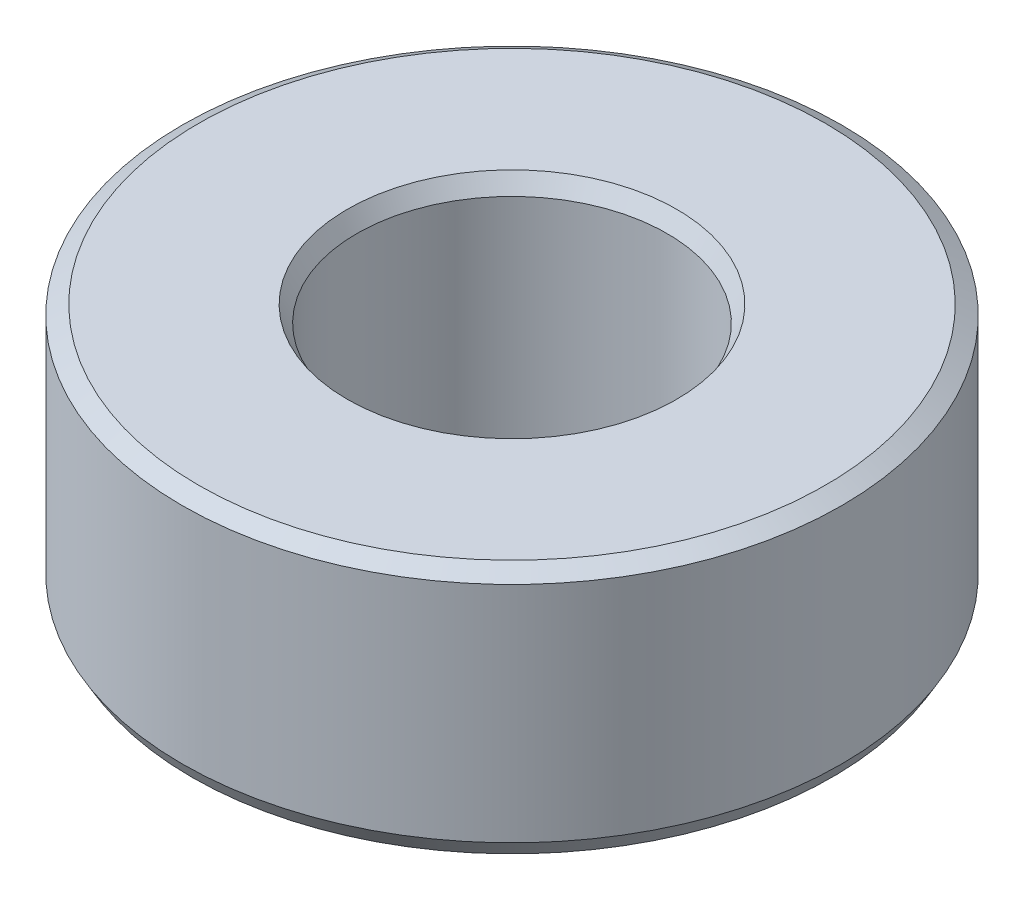
from build123d import *
from OCP.BRepFilletAPI import BRepFilletAPI_MakeChamfer

# Parameters (mm, degrees)
SKETCH1_R           = 42.5
BOSS_EXTRUDE1_DEPTH = 32.165456975
SKETCH2_R           = 20.000723555
CUT_EXTRUDE1_DEPTH  = 69.169763256
CHAMFER1_SIZE       = 1.22924229
CHAMFER1_SIZE2      = 2.096885179


with BuildPart() as part:
    # Sketch1 → Boss-Extrude1 (new body)
    with BuildSketch(Plane(origin=(0, 0, 0), x_dir=(1, 0, 0), z_dir=(0, 1, 0))):
        Circle(SKETCH1_R)
    extrude(amount=BOSS_EXTRUDE1_DEPTH)

    # Sketch2 → Cut-Extrude1 (cut, through all)
    with BuildSketch(Plane(origin=(0, 0, 0), x_dir=(1, 0, 0), z_dir=(0, 1, 0))):
        Circle(SKETCH2_R)
    extrude(amount=CUT_EXTRUDE1_DEPTH, mode=Mode.SUBTRACT)

    # Chamfer1: one chamfer whose edges measure the first distance from different faces: ONE call of the kernel's chamfer builder (chamfer() names one face for all edges)
    chamfer1_edges_1 = [part.edges().sort_by_distance(p)[0] for p in [
        (-20.000723555, 32.165456975, 0),
    ]]
    chamfer1_side_1 = [part.faces().sort_by_distance(p)[0] for p in [
        (-41.297918472, 32.165456975, 0),
    ]]
    chamfer1_edges_2 = [part.edges().sort_by_distance(p)[0] for p in [
        (-20.000723555, 0, 0),
    ]]
    chamfer1_side_2 = [part.faces().sort_by_distance(p)[0] for p in [
        (-20.000723555, 16.082728487, 0),
    ]]
    chamfer1_edges_3 = [part.edges().sort_by_distance(p)[0] for p in [
        (-42.5, 0, 0),
    ]]
    chamfer1_side_3 = [part.faces().sort_by_distance(p)[0] for p in [
        (-41.297918472, 0, 0),
    ]]
    chamfer1_edges_4 = [part.edges().sort_by_distance(p)[0] for p in [
        (-42.5, 32.165456975, 0),
    ]]
    chamfer1_side_4 = [part.faces().sort_by_distance(p)[0] for p in [
        (-42.5, 16.082728487, 0),
    ]]
    chamfer1 = BRepFilletAPI_MakeChamfer(part.part.solid().wrapped)
    for e in chamfer1_edges_1:
        chamfer1.Add(CHAMFER1_SIZE, CHAMFER1_SIZE2, e.wrapped, chamfer1_side_1[0].wrapped)  # the first distance lies on this face
    for e in chamfer1_edges_2:
        chamfer1.Add(CHAMFER1_SIZE, CHAMFER1_SIZE2, e.wrapped, chamfer1_side_2[0].wrapped)  # the first distance lies on this face
    for e in chamfer1_edges_3:
        chamfer1.Add(CHAMFER1_SIZE, CHAMFER1_SIZE2, e.wrapped, chamfer1_side_3[0].wrapped)  # the first distance lies on this face
    for e in chamfer1_edges_4:
        chamfer1.Add(CHAMFER1_SIZE, CHAMFER1_SIZE2, e.wrapped, chamfer1_side_4[0].wrapped)  # the first distance lies on this face
    add(Compound.cast(chamfer1.Shape()), mode=Mode.REPLACE)


solid = part.part
